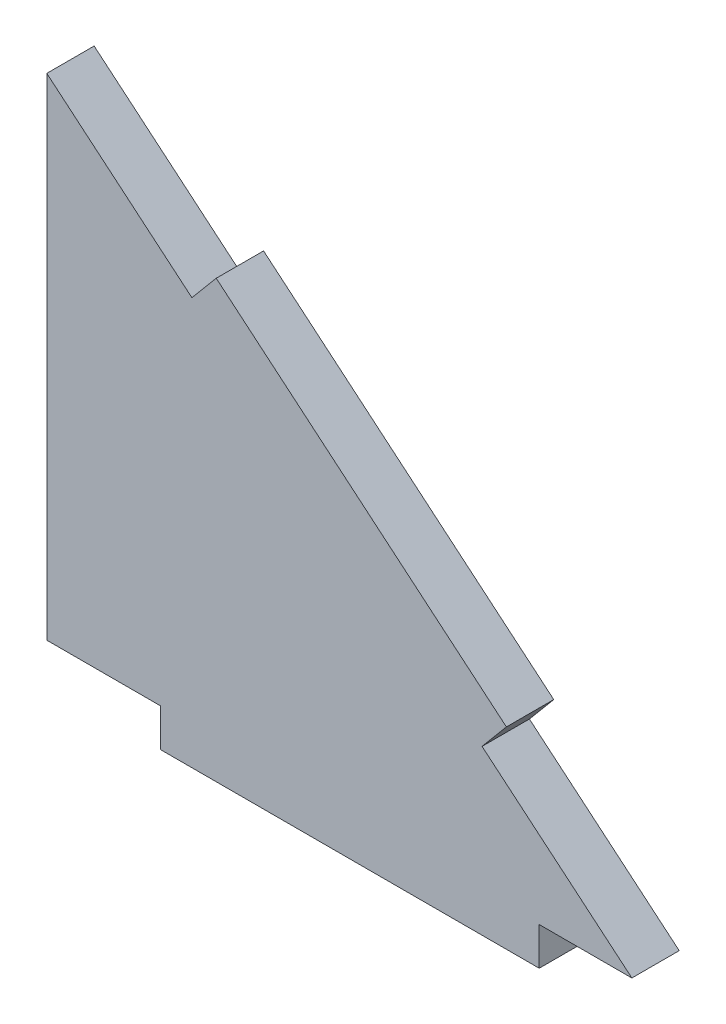
from build123d import *

# Parameters (mm, degrees)
EXTRUDE_1_DEPTH = 5


with BuildPart() as part:
    # 草图1 → 凸台-拉伸1 (new body)
    with BuildSketch(Plane.XY):
        Polygon((-23.020433608, 5.056034895), (-23.020433608, 9.056034895), (-35.020433608, 9.056034895), (-35.020433608, 60.896855616), (-19.699544746, 48.041103423), (-17.128394307, 51.105281195), (13.513383418, 25.393776808), (10.942232979, 22.329599035), (24.83868432, 10.66909184), (25.702528361, 9.944240624), (26.761050729, 9.056034895), (16.979566392, 9.056034895), (16.979566392, 5.056034895), align=None)
    extrude(amount=EXTRUDE_1_DEPTH)


solid = part.part
